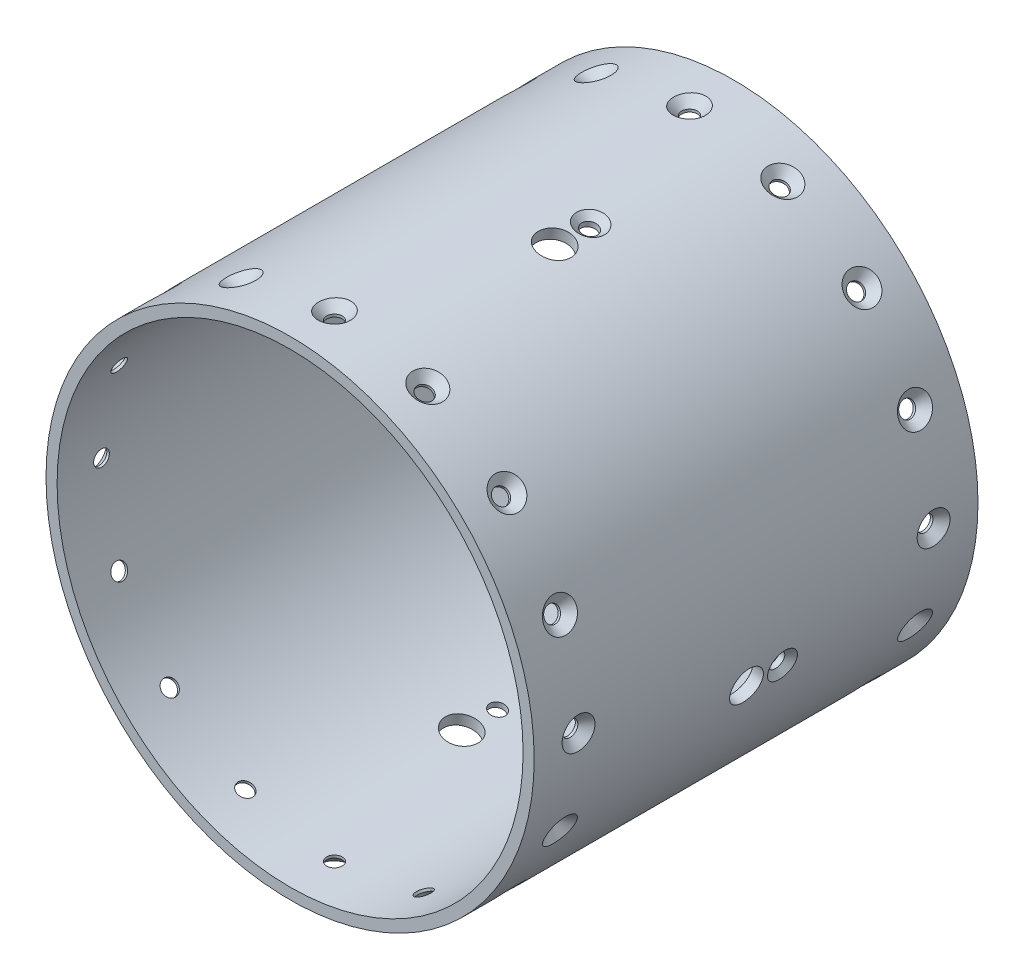
from build123d import *

# Parameters (mm, degrees)
SKETCH1_R         = 69.85
SKETCH1_R_2       = 66.675
EXTRUDE1_DEPTH    = 127
CIRPATTERN1_COUNT = 16
CIRPATTERN2_COUNT = 4


with BuildPart() as part:
    # Sketch1 → Extrude1 (new body)
    with BuildSketch(Plane.XY):
        Circle(SKETCH1_R)
        Circle(SKETCH1_R_2, mode=Mode.SUBTRACT)
    extrude(amount=EXTRUDE1_DEPTH)

    # Sketch12 → CSK for M4 Flat Head Machine Screw1 (revolve, cut)
    with BuildSketch(Plane(origin=(69.85, 0, 114.3), x_dir=(0, 0, -1), z_dir=(0, 1, 0))):
        Polygon((0, 0), (0, 13.543936393), (2.25, 12.192), (2.25, 2.45), (4.7, 0), align=None)
    csk_for_m4_flat_head_machine_screw1 = revolve(axis=Axis((76.2, 0, 114.3), (-1, 0, 0)), mode=Mode.SUBTRACT)

    # Sketch30 → CSK for M4 Flat Head Machine Screw2 (revolve, cut)
    with BuildSketch(Plane(origin=(69.85, 0, 12.7), x_dir=(0, 0, -1), z_dir=(0, 1, 0))):
        Polygon((0, 0), (0, 13.543936393), (2.25, 12.192), (2.25, 2.45), (4.7, 0), align=None)
    csk_for_m4_flat_head_machine_screw2 = revolve(axis=Axis((76.2, 0, 12.7), (-1, 0, 0)), mode=Mode.SUBTRACT)

    # CirPattern1: CSK for M4 Flat Head Machine Screw1, CSK for M4 Flat Head Machine Screw2 ×16 about axis
    cirpattern1_axis = Axis((0, 0, 127), (0, 0, -1))
    add([csk_for_m4_flat_head_machine_screw1.rotate(cirpattern1_axis, i * 360 / CIRPATTERN1_COUNT) for i in range(1, CIRPATTERN1_COUNT)], mode=Mode.SUBTRACT)
    add([csk_for_m4_flat_head_machine_screw2.rotate(cirpattern1_axis, i * 360 / CIRPATTERN1_COUNT) for i in range(1, CIRPATTERN1_COUNT)], mode=Mode.SUBTRACT)

    # Sketch32 → 3/8 (0.375) Diameter Hole1 (revolve, cut)
    with BuildSketch(Plane(origin=(68.507851836, -13.627058993, 64.890747868), x_dir=(0.19509032201612853, 0.9807852804032304, 0), z_dir=(0, 0, 1))):
        Polygon((0, 0), (0, 15.561598698), (4.7625, 12.7), (4.7625, 0), align=None)
    f_3_8_0_375_diameter_hole1 = revolve(axis=Axis((74.735838367, -14.865882538, 64.890747868), (-0.9807852804032304, 0.19509032201612855, 0)), mode=Mode.SUBTRACT)

    # Sketch22 → CSK for #8 Flat Head Machine Screw (100)2 (revolve, cut)
    with BuildSketch(Plane(origin=(68.507851836, -13.627058993, 54.61), x_dir=(0.19509032201612853, 0.9807852804032304, 0), z_dir=(0, 0, 1))):
        Polygon((0, 0), (0, 13.542674586), (2.2479, 12.192), (2.2479, 1.651767624), (4.2164, 0), align=None)
    csk_for_8_flat_head_machine_screw_100 = revolve(axis=Axis((74.735838367, -14.865882538, 54.61), (-0.9807852804032304, 0.19509032201612855, 0)), mode=Mode.SUBTRACT)

    # CirPattern2: 3/8 (0.375) Diameter Hole1, CSK for #8 Flat Head Machine Screw (100)2 ×4 about axis
    cirpattern2_axis = Axis((0, 0, 127), (0, 0, -1))
    add([f_3_8_0_375_diameter_hole1.rotate(cirpattern2_axis, i * 360 / CIRPATTERN2_COUNT) for i in range(1, CIRPATTERN2_COUNT)], mode=Mode.SUBTRACT)
    add([csk_for_8_flat_head_machine_screw_100.rotate(cirpattern2_axis, i * 360 / CIRPATTERN2_COUNT) for i in range(1, CIRPATTERN2_COUNT)], mode=Mode.SUBTRACT)


solid = part.part
